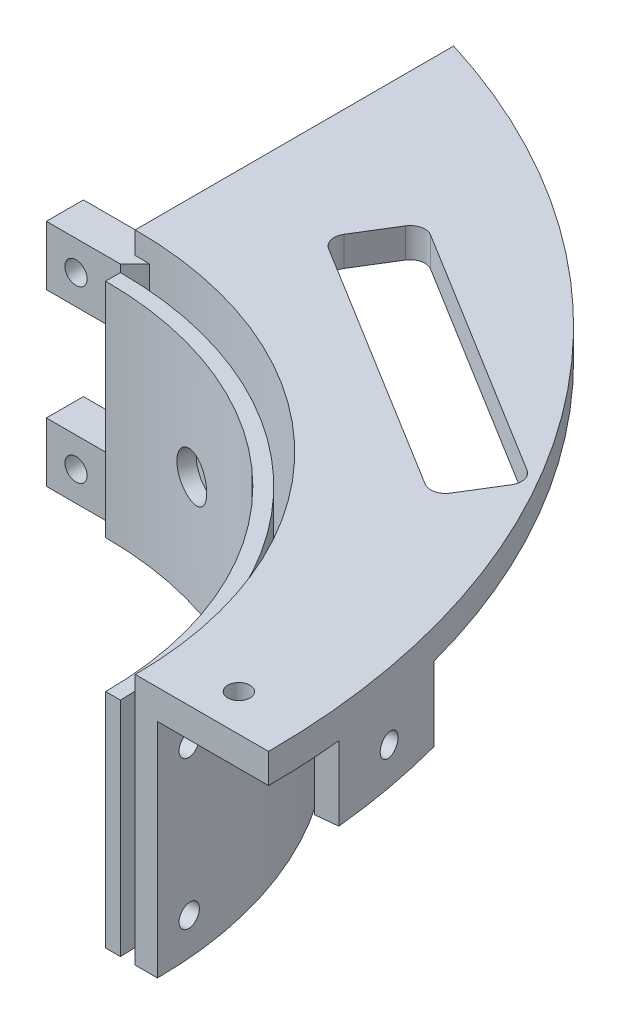
from build123d import *
from build123d.topology import SkipClean

# Parameters (mm, degrees)
BOSS_EXTRUDE1_DEPTH                  = 15
BOSS_EXTRUDE3_DEPTH                  = 15
BOSS_EXTRUDE4_REACH                  = 66.59
BOSS_EXTRUDE4_END_RADIUS             = 52
SKETCH2_R                            = 3.9
BOSS_EXTRUDE4_DIRECTION_2_REACH      = 66.59
BOSS_EXTRUDE4_DIRECTION_2_END_RADIUS = 50
BOSS_EXTRUDE5_REACH                  = 61.954
BOSS_EXTRUDE5_END_RADIUS             = 52
SKETCH4_R                            = 5.6
BOSS_EXTRUDE5_DIRECTION_2_REACH      = 61.954
BOSS_EXTRUDE5_DIRECTION_2_END_RADIUS = 50
CUT_EXTRUDE1_DEPTH                   = 65.589910379
CUT_EXTRUDE1_DEPTH_BACK              = 65.589910379
SKETCH5_R                            = 1.5
SKETCH6_R                            = 3
CUT_EXTRUDE2_DEPTH                   = 65.589910379
CUT_EXTRUDE3_DEPTH                   = 60.953724142
CUT_EXTRUDE3_DEPTH_BACK              = 60.953724142
SKETCH7_R                            = 1.5
SKETCH8_R                            = 3
CUT_EXTRUDE4_DEPTH                   = 60.953724142
BOSS_EXTRUDE6_DEPTH                  = 4
SKETCH12_R                           = 1.5
CUT_EXTRUDE6_DEPTH                   = 92.433035695
BOSS_EXTRUDE7_DEPTH                  = 10
CUT_EXTRUDE10_REACH                  = 106.962
CUT_EXTRUDE10_END_RADIUS             = 96.464285714
SKETCH21_R                           = 1.5
CUT_EXTRUDE11_REACH                  = 106.952
CUT_EXTRUDE11_END_RADIUS             = 96.464285714
SKETCH22_R                           = 1.5
SKETCH30_W                           = 5
SKETCH30_H                           = 8
BOSS_EXTRUDE10_DEPTH                 = 10
SKETCH31_R                           = 1.5
CUT_EXTRUDE16_DEPTH                  = 5
SKETCH32_R                           = 3
CUT_EXTRUDE17_DEPTH                  = 2
CHAMFER1_START                       = -15
CHAMFER1_DEPTH                       = 8
CHAMFER1_START_2                     = 8
CHAMFER1_2_DEPTH                     = 8
SKETCH36_R                           = 1.5
CUT_EXTRUDE20_DEPTH                  = 83.41834451
CUT_EXTRUDE21_DEPTH                  = 92.433035772
CUT_EXTRUDE21_DEPTH_BACK             = 92.433035772
FILLET1_R                            = 2


with BuildPart() as part:
    # Sketch1 → Boss-Extrude1 (new, symmetric)
    with BuildSketch(Plane(origin=(0, 0, 0), x_dir=(1, 0, 0), z_dir=(0, 1, 0))):
        with BuildLine():
            Line((0, 0), (0, 2))
            ThreePointArc((0, 2), (35.355339059, -12.644660941), (50, -48))
            Line((50, -48), (48, -48))
            ThreePointArc((48, -48), (33.941125497, -14.058874503), (0, 0))
        make_face()
    extrude(amount=BOSS_EXTRUDE1_DEPTH, both=True)

    # Boss-Extrude4: up to this cylinder (the profile starts inside it)
    boss_extrude4_end = Plane(origin=(0, 0, 48), z_dir=(0, -1, 0)) * Cylinder(BOSS_EXTRUDE4_END_RADIUS, 238.18, mode=Mode.PRIVATE)
    # Sketch2 → Boss-Extrude4 (add, up to the surface)
    with BuildSketch(Plane(origin=(14.346758998, 0, 0.1025), x_dir=(-0.9579500000000001, 0, -0.2869351799623044), z_dir=(0.28693517996230433, 0, -0.95795)), mode=Mode.PRIVATE) as boss_extrude4_sk1:
        with Locations(Location((0, 0, 0), (0, 0, 180))):
            Circle(SKETCH2_R)
    boss_extrude4_tool1 = extrude(boss_extrude4_sk1.sketch, amount=BOSS_EXTRUDE4_REACH, mode=Mode.PRIVATE) & boss_extrude4_end
    add(boss_extrude4_tool1.solids().sort_by_distance((14.346759, 0, 0.1025))[0])

    # Boss-Extrude4 direction 2: up to this cylinder (the profile starts outside it)
    with SkipClean():  # the faces are left unmerged after this step: merging them gives an invalid solid
        boss_extrude4_direction_2_end = Plane(origin=(0, 0, 48), z_dir=(0, -1, 0)) * Cylinder(BOSS_EXTRUDE4_DIRECTION_2_END_RADIUS, 234.18, mode=Mode.PRIVATE)
        # Sketch2 → Boss-Extrude4 direction 2 (add, up to the surface)
        with BuildSketch(Plane(origin=(14.346758998, 0, 0.1025), x_dir=(-0.9579500000000001, 0, -0.2869351799623044), z_dir=(0.28693517996230433, 0, -0.95795)), mode=Mode.PRIVATE) as boss_extrude4_direction_2_sk1:
            with Locations(Location((0, 0, 0), (0, 0, 180))):
                Circle(SKETCH2_R)
        boss_extrude4_direction_2_tool1 = extrude(boss_extrude4_direction_2_sk1.sketch, amount=-BOSS_EXTRUDE4_DIRECTION_2_REACH, mode=Mode.PRIVATE) - boss_extrude4_direction_2_end
        add(boss_extrude4_direction_2_tool1.solids().sort_by_distance((14.346759, 0, 0.1025))[0])
        add(boss_extrude4_direction_2_tool1.solids().sort_by_distance((14.346759, 0, 0.1025))[1])

    # Boss-Extrude5: up to this cylinder (the profile starts inside it)
    boss_extrude5_end = Plane(origin=(0, 0, 48), z_dir=(0, -1, 0)) * Cylinder(BOSS_EXTRUDE5_END_RADIUS, 228.908, mode=Mode.PRIVATE)
    # Sketch4 → Boss-Extrude5 (add, up to the surface)
    with BuildSketch(Plane(origin=(46, 0, 28.404082058), x_dir=(-0.3919183588453085, 0, -0.92), z_dir=(0.9199999999999999, 0, -0.39191835884530846)), mode=Mode.PRIVATE) as boss_extrude5_sk1:
        with Locations(Location((0, 0, 0), (0, 0, 180))):
            Circle(SKETCH4_R)
    boss_extrude5_tool1 = extrude(boss_extrude5_sk1.sketch, amount=BOSS_EXTRUDE5_REACH, mode=Mode.PRIVATE) & boss_extrude5_end
    add(boss_extrude5_tool1.solids().sort_by_distance((46, 0, 28.404082))[0])

    # Boss-Extrude5 direction 2: up to this cylinder (the profile starts outside it)
    boss_extrude5_direction_2_end = Plane(origin=(0, 0, 48), z_dir=(0, -1, 0)) * Cylinder(BOSS_EXTRUDE5_DIRECTION_2_END_RADIUS, 224.908, mode=Mode.PRIVATE)
    # Sketch4 → Boss-Extrude5 direction 2 (add, up to the surface)
    with BuildSketch(Plane(origin=(46, 0, 28.404082058), x_dir=(-0.3919183588453085, 0, -0.92), z_dir=(0.9199999999999999, 0, -0.39191835884530846)), mode=Mode.PRIVATE) as boss_extrude5_direction_2_sk1:
        with Locations(Location((0, 0, 0), (0, 0, 180))):
            Circle(SKETCH4_R)
    boss_extrude5_direction_2_tool1 = extrude(boss_extrude5_direction_2_sk1.sketch, amount=-BOSS_EXTRUDE5_DIRECTION_2_REACH, mode=Mode.PRIVATE) - boss_extrude5_direction_2_end
    add(boss_extrude5_direction_2_tool1.solids().sort_by_distance((46, 0, 28.404082))[0])
    add(boss_extrude5_direction_2_tool1.solids().sort_by_distance((46, 0, 28.404082))[1])

    # Sketch5 → Cut-Extrude1 (cut, two sides: drawn at the far end of the back side and taken through both)
    with BuildSketch(Plane(origin=(14.346758998, 0, 0.1025), x_dir=(-0.9579500000000001, 0, -0.2869351799623044), z_dir=(0.28693517996230433, 0, -0.95795)).offset(-CUT_EXTRUDE1_DEPTH_BACK)):
        Circle(SKETCH5_R)
    extrude(amount=CUT_EXTRUDE1_DEPTH + CUT_EXTRUDE1_DEPTH_BACK, mode=Mode.SUBTRACT)

    # Sketch6 → Cut-Extrude2 (cut, through all)
    with BuildSketch(Plane(origin=(14.346758998, 0, 0.1025), x_dir=(-0.9579500000000001, 0, -0.2869351799623044), z_dir=(0.28693517996230433, 0, -0.95795))):
        Circle(SKETCH6_R)
    extrude(amount=-CUT_EXTRUDE2_DEPTH, mode=Mode.SUBTRACT)

    # Sketch7 → Cut-Extrude3 (cut, two sides: drawn at the far end of the back side and taken through both)
    with BuildSketch(Plane(origin=(46, 0, 28.404082058), x_dir=(-0.3919183588453085, 0, -0.92), z_dir=(0.9199999999999999, 0, -0.39191835884530846)).offset(-CUT_EXTRUDE3_DEPTH_BACK)):
        Circle(SKETCH7_R)
    extrude(amount=CUT_EXTRUDE3_DEPTH + CUT_EXTRUDE3_DEPTH_BACK, mode=Mode.SUBTRACT)

    # Sketch8 → Cut-Extrude4 (cut, through all)
    with BuildSketch(Plane(origin=(46, 0, 28.404082058), x_dir=(-0.3919183588453085, 0, -0.92), z_dir=(0.9199999999999999, 0, -0.39191835884530846))):
        Circle(SKETCH8_R)
    extrude(amount=-CUT_EXTRUDE4_DEPTH, mode=Mode.SUBTRACT)


with BuildPart() as body_2:
    # Sketch3 → Boss-Extrude3 (new, symmetric)
    with BuildSketch(Plane(origin=(0, 0, 0), x_dir=(1, 0, 0), z_dir=(0, 1, 0))):
        with BuildLine():
            Line((0, 4), (0, 7))
            ThreePointArc((0, 7), (38.890872965, -9.109127035), (55, -48))
            Line((55, -48), (52, -48))
            ThreePointArc((52, -48), (36.769552622, -11.230447378), (0, 4))
        make_face()
    extrude(amount=BOSS_EXTRUDE3_DEPTH, both=True)

    # Sketch9 → Boss-Extrude6 (add)
    with BuildSketch(Plane(origin=(0, 15, 0), x_dir=(1, 0, 0), z_dir=(0, 1, 0))):
        with BuildLine():
            Line((0, 4), (0, 47))
            ThreePointArc((0, 47), (50.610018108, 11.002118606), (70, -48))
            Line((70, -48), (52, -48))
            ThreePointArc((52, -48), (36.769552622, -11.230447378), (0, 4))
        make_face()
    extrude(amount=BOSS_EXTRUDE6_DEPTH)

    # Sketch12 → Cut-Extrude6 (cut, through all)
    with BuildSketch(Plane(origin=(0, 19, 0), x_dir=(-1, 0, 0), z_dir=(0, -1, 0))):
        with Locations((5, 25.5)):
            Circle(SKETCH12_R)
        with Locations(Location((-61, -43, 0), (0, 0, 90))):
            Circle(SKETCH12_R)
    extrude(amount=CUT_EXTRUDE6_DEPTH, mode=Mode.SUBTRACT)

    # Sketch19 → Boss-Extrude7 (add)
    with BuildSketch(Plane(origin=(0, 15, 0), x_dir=(-1, 0, 0), z_dir=(0, 1, 0))):
        with BuildLine():
            Line((-66.612250671, 22.262026324), (-63.714430543, 23.038324273))
            ThreePointArc((-63.714430543, 23.038324273), (-65.420238614, 30.613641514), (-66.511230759, 38.301615799))
            Line((-66.511230759, 38.301615799), (-69.496030234, 38))
            ThreePointArc((-69.496030234, 38), (-68.371108678, 30.072932846), (-66.612250671, 22.262026324))
        make_face()
        with BuildLine():
            Line((-21.968914555, -33.608727036), (-23.568466137, -36.146725211))
            ThreePointArc((-23.568466137, -36.146725211), (-16.628654889, -40.139576577), (-9.390178773, -43.561316734))
            Line((-9.390178773, -43.561316734), (-8.218266739, -40.799682764))
            ThreePointArc((-8.218266739, -40.799682764), (-15.238418979, -37.481147696), (-21.968914555, -33.608727036))
        make_face()
    extrude(amount=-BOSS_EXTRUDE7_DEPTH)

    # Cut-Extrude10: up to this cylinder (the profile starts outside it)
    cut_extrude10_end = Plane(origin=(-29.464285714, 10, 48), z_dir=(0, 1, 0)) * Cylinder(CUT_EXTRUDE10_END_RADIUS, 407.852571429, mode=Mode.PRIVATE)
    # Sketch21 → Cut-Extrude10 (cut, up to the surface)
    with BuildSketch(Plane(origin=(16.628654889, 5, -40.139576577), x_dir=(-0.8861429602003462, 0, -0.463411970159779), z_dir=(0.463411970159779, 0, -0.8861429602003462)), mode=Mode.PRIVATE) as cut_extrude10_sk1:
        with Locations((0, 5)):
            Circle(SKETCH21_R)
    cut_extrude10_tool1 = extrude(cut_extrude10_sk1.sketch, amount=-CUT_EXTRUDE10_REACH, mode=Mode.PRIVATE) - cut_extrude10_end
    add(cut_extrude10_tool1.solids().sort_by_distance((16.628655, 10, -40.139577))[0], mode=Mode.SUBTRACT)

    # Cut-Extrude11: up to this cylinder (the profile starts outside it)
    cut_extrude11_end = Plane(origin=(-29.464285714, 10, 48), z_dir=(0, 1, 0)) * Cylinder(CUT_EXTRUDE11_END_RADIUS, 407.832571429, mode=Mode.PRIVATE)
    # Sketch22 → Cut-Extrude11 (cut, up to the surface)
    with BuildSketch(Plane(origin=(68.371108678, 5, 30.072932846), x_dir=(-0.18023622273777445, 0, -0.9836233547518173), z_dir=(0.9836233547518173, 0, -0.18023622273777445)), mode=Mode.PRIVATE) as cut_extrude11_sk1:
        with Locations((0, 5)):
            Circle(SKETCH22_R)
    cut_extrude11_tool1 = extrude(cut_extrude11_sk1.sketch, amount=-CUT_EXTRUDE11_REACH, mode=Mode.PRIVATE) - cut_extrude11_end
    add(cut_extrude11_tool1.solids().sort_by_distance((68.371109, 10, 30.072933))[0], mode=Mode.SUBTRACT)

    # Sketch30 → Boss-Extrude10 (add)
    with BuildSketch(Plane.ZY):
        with Locations((-4.5, 12)):
            Rectangle(SKETCH30_W, SKETCH30_H)
        with Locations((-4.5, -11)):
            Rectangle(SKETCH30_W, SKETCH30_H)
    extrude(amount=BOSS_EXTRUDE10_DEPTH)

    # Sketch31 → Cut-Extrude16 (cut)
    with BuildSketch(Plane(origin=(0, 0, -7), x_dir=(-1, 0, 0), z_dir=(0, 0, -1))):
        with Locations((6, 12)):
            Circle(SKETCH31_R)
        with Locations((6, -11)):
            Circle(SKETCH31_R)
    extrude(amount=-CUT_EXTRUDE16_DEPTH, mode=Mode.SUBTRACT)

    # Sketch32 → Cut-Extrude17 (cut)
    with BuildSketch(Plane(origin=(0, 0, -7), x_dir=(-1, 0, 0), z_dir=(0, 0, -1))):
        with Locations((6, 12)):
            Circle(SKETCH32_R)
        with Locations((6, -11)):
            Circle(SKETCH32_R)
    extrude(amount=-CUT_EXTRUDE17_DEPTH, mode=Mode.SUBTRACT)

    # Chamfer1: read off the stored shape, not the designer's step
    # Chamfer1 outline → Chamfer1 (add)
    with BuildSketch(Plane(origin=(0, 0, 0), x_dir=(1, 0, 0), z_dir=(0, 1, 0)).offset(CHAMFER1_START)):
        with BuildLine():
            Line((0.041649987, 2), (2.08, 3.958383347))
            ThreePointArc((2.08, 3.958383347), (1.040208146, 3.989594796), (0, 4))
            Line((0, 4), (0, 2))
            Line((0, 2), (0.041649987, 2))
        make_face()
    extrude(amount=CHAMFER1_DEPTH)

    # Chamfer1 2 outline → Chamfer1 2 (add)
    with BuildSketch(Plane(origin=(0, 0, 0), x_dir=(1, 0, 0), z_dir=(0, 1, 0)).offset(CHAMFER1_START_2)):
        with BuildLine():
            Line((0, 2), (1.962937525, 3.962937525))
            ThreePointArc((1.962937525, 3.962937525), (0.981643692, 3.990733556), (0, 4))
            Line((0, 4), (0, 2))
        make_face()
    extrude(amount=CHAMFER1_2_DEPTH)

    # Sketch36 → Cut-Extrude20 (cut, through all)
    with BuildSketch(Plane(origin=(50.907994954, 0, -4.172786472), x_dir=(-0.08169323944527149, 0, -0.9966575212323125), z_dir=(0.9966575212323125, 0, -0.08169323944527149))):
        with Locations((-47.839561019, 10)):
            Circle(SKETCH36_R)
        with Locations((-47.839561019, -10)):
            Circle(SKETCH36_R)
    extrude(amount=-CUT_EXTRUDE20_DEPTH, mode=Mode.SUBTRACT)

    # Sketch37 → Cut-Extrude21 (cut, two sides: drawn at the far end of the back side and taken through both)
    with BuildSketch(Plane.XZ.offset(15).offset(-CUT_EXTRUDE21_DEPTH_BACK)):
        Polygon((18.824487768, -24.400888532), (56.269400194, -1.295076852), (51.018079357, 7.215130518), (13.573166931, -15.890681163), align=None)
    extrude(amount=CUT_EXTRUDE21_DEPTH + CUT_EXTRUDE21_DEPTH_BACK, mode=Mode.SUBTRACT)

    # Fillet1
    fillet1_edges = [body_2.edges().sort_by_distance(p)[0] for p in [
        (56.269400194, 17, -1.295076852),
        (18.824487768, 17, -24.400888532),
        (13.573166931, 17, -15.890681163),
        (51.018079357, 17, 7.215130518),
    ]]
    fillet(fillet1_edges, radius=FILLET1_R)


solid = Compound([part.part, body_2.part])
